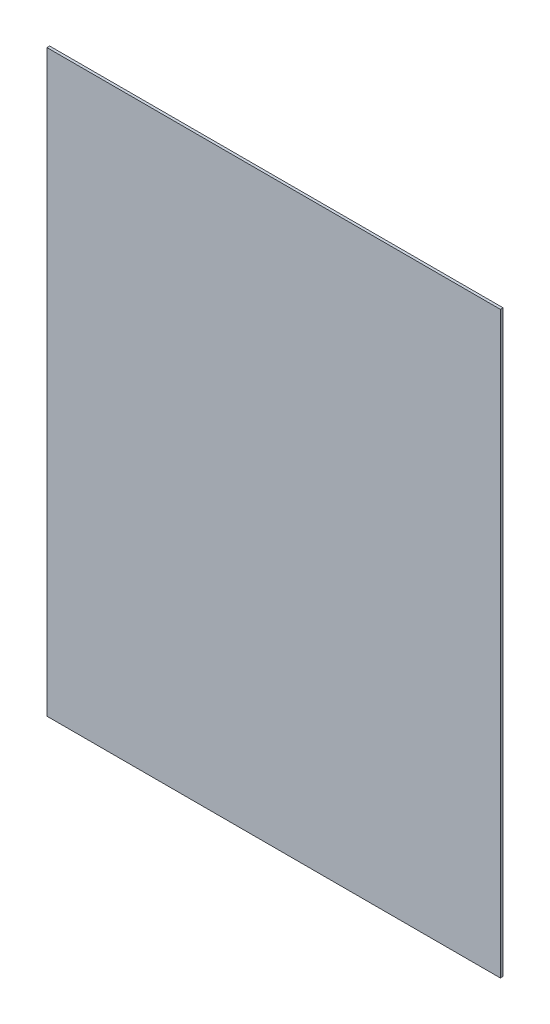
from build123d import *

# Parameters (mm, degrees)
SKICA1_W                = 505
SKICA1_H                = 645
P_IDAT_VYSUNUT_M1_DEPTH = 3


with BuildPart() as part:
    # Skica1 → Přidat vysunutím1 (new body)
    with BuildSketch(Plane.XY):
        Rectangle(SKICA1_W, SKICA1_H)
    extrude(amount=P_IDAT_VYSUNUT_M1_DEPTH)


solid = part.part
